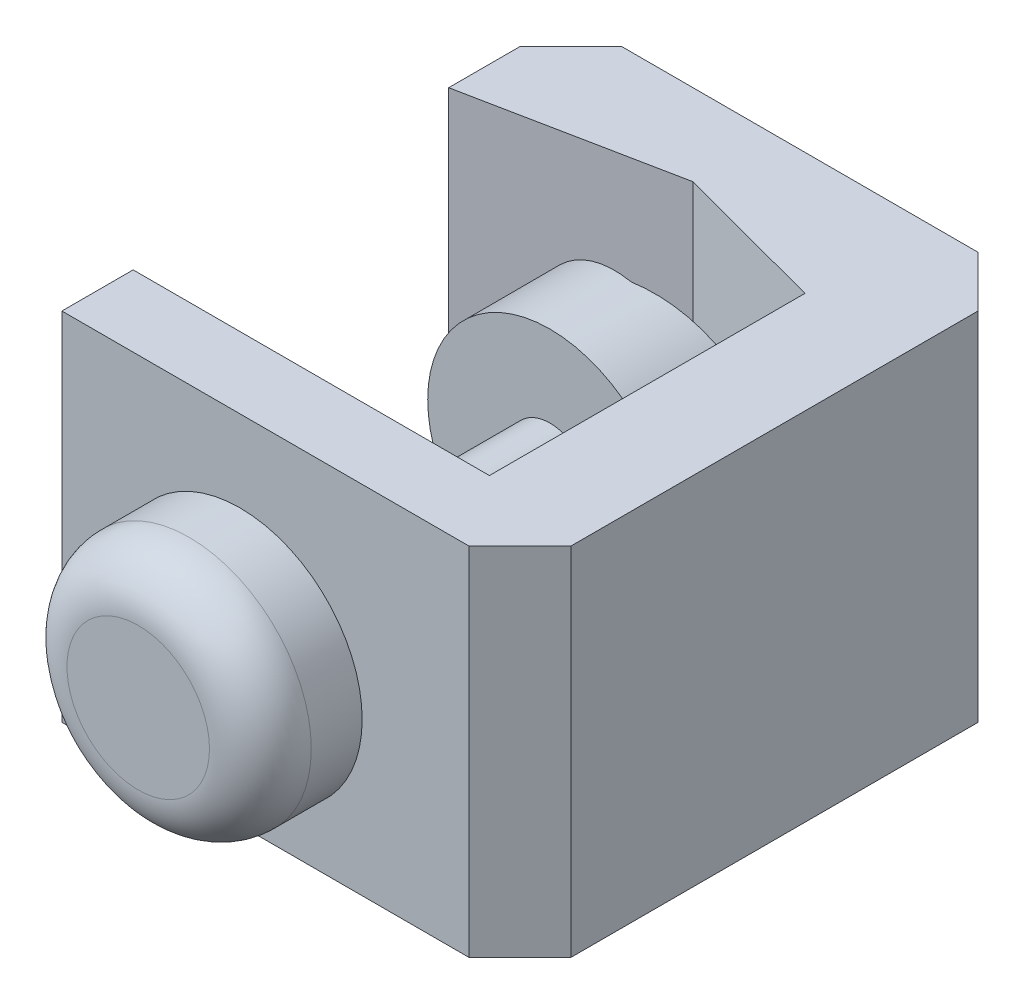
from build123d import *

# Parameters (mm, degrees)
SKETCH1_W                = 45
SKETCH1_H                = 35
BOSS_EXTRUDE1_DEPTH      = 50
CUT_EXTRUDE1_DEPTH       = 35
BOSS_EXTRUDE2_DEPTH      = 2.5
BOSS_EXTRUDE2_DEPTH_BACK = 27.94
SKETCH3_R                = 4
BOSS_EXTRUDE3_START      = 2.5
SKETCH3_3_R              = 12
BOSS_EXTRUDE3_DEPTH      = 10
BOSS_EXTRUDE6_START      = -27.94
SKETCH3_4_R              = 12
BOSS_EXTRUDE6_DEPTH      = 10
FILLET1_R                = 5
CUT_EXTRUDE2_START       = -29.5000001
CUT_EXTRUDE2_DEPTH       = 24.0000001
CHAMFER1_SIZE            = 5
SKETCH5_R                = 5
CUT_EXTRUDE3_DEPTH       = 5


# Read off the part's stored shape, not the designer's step: Cut-Extrude2
with BuildPart() as part:
    # Sketch1 → Boss-Extrude1 (new body)
    with BuildSketch(Plane.XY):
        with Locations((2.5, 0)):
            Rectangle(SKETCH1_W, SKETCH1_H)
    extrude(amount=BOSS_EXTRUDE1_DEPTH)

    # Sketch2 → Cut-Extrude1 (cut)
    with BuildSketch(Plane.XZ.offset(17.5)):
        Polygon((-20, 43), (15, 43), (15, 12), (0, 8), (-20, 12), align=None)
    extrude(amount=-CUT_EXTRUDE1_DEPTH, mode=Mode.SUBTRACT)

    # Sketch3 → Boss-Extrude2 (add, two sides: drawn at the far end of the back side and taken through both)
    with BuildSketch(Plane.XY.offset(50).offset(-BOSS_EXTRUDE2_DEPTH_BACK)):
        Circle(SKETCH3_R)
    extrude(amount=BOSS_EXTRUDE2_DEPTH + BOSS_EXTRUDE2_DEPTH_BACK)

    # Sketch3<3> → Boss-Extrude3 (add)
    with BuildSketch(Plane.XY.offset(50).offset(BOSS_EXTRUDE3_START)):
        Circle(SKETCH3_3_R)
    extrude(amount=BOSS_EXTRUDE3_DEPTH)

    # Fillet1
    fillet1_edges = [part.edges().sort_by_distance(p)[0] for p in [
        (-12, 0, 62.5),
    ]]
    fillet(fillet1_edges, radius=FILLET1_R)

    # Chamfer1
    chamfer1_edges = [part.edges().sort_by_distance(p)[0] for p in [
        (25, 0, 50),
        (25, 0, 0),
        (-20, 0, 0),
    ]]
    chamfer(chamfer1_edges, length=CHAMFER1_SIZE)

    # Sketch5 → Cut-Extrude3 (cut)
    with BuildSketch(Plane(origin=(0, 0, 0), x_dir=(-1, 0, 0), z_dir=(0, 0, -1))):
        with Locations((-2.5, 0)):
            Circle(SKETCH5_R)
    extrude(amount=-CUT_EXTRUDE3_DEPTH, mode=Mode.SUBTRACT)


with BuildPart() as body_2:
    # Sketch3<4> → Boss-Extrude6 (new body)
    with BuildSketch(Plane.XY.offset(50).offset(BOSS_EXTRUDE6_START)):
        Circle(SKETCH3_4_R)
    extrude(amount=-BOSS_EXTRUDE6_DEPTH)

    # Cut-Extrude2 outline → Cut-Extrude2 (cut)
    with BuildSketch(Plane.XZ.offset(17.5).offset(CUT_EXTRUDE2_START)):
        Polygon((12, 12.06), (0, 14.06), (-12, 12.06), align=None)
    extrude(amount=CUT_EXTRUDE2_DEPTH, mode=Mode.SUBTRACT)


solid = Compound([part.part, body_2.part])
